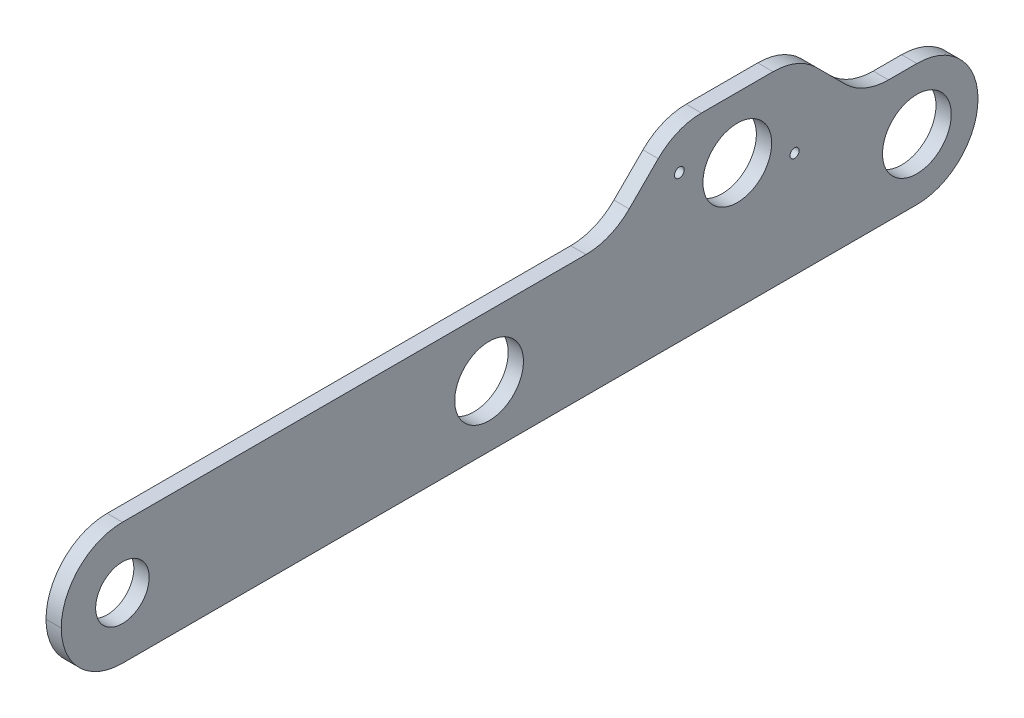
from build123d import *

# Parameters (mm, degrees)
SKETCH1_R           = 11.1125
SKETCH1_R_2         = 14.2875
SKETCH1_R_3         = 1.903475963
SKETCH1_R_4         = 2.0193
BOSS_EXTRUDE1_DEPTH = 6.35
FILLET1_R           = 25.4


with BuildPart() as part:
    # Sketch1 → Boss-Extrude1 (new body)
    with BuildSketch(Plane(origin=(0, 0, 0), x_dir=(0, 0, -1), z_dir=(1, 0, 0))):
        Polygon((0, 0), (0, 50.8), (228.6, 50.8), (255.540768363, 77.740768363), (306.340768363, 77.740768363), (333.281536726, 50.8), (381, 50.8), (381, 0), align=None)
        with Locations((25.4, 25.4)):
            Circle(SKETCH1_R, mode=Mode.SUBTRACT)
        with Locations((280.957536726, 52.340768363)):
            Circle(SKETCH1_R_2, mode=Mode.SUBTRACT)
        with Locations((355.6, 25.4)):
            Circle(SKETCH1_R_2, mode=Mode.SUBTRACT)
        with Locations((177.8, 25.4)):
            Circle(SKETCH1_R_2, mode=Mode.SUBTRACT)
        with Locations((304.762985996, 43.955677033)):
            Circle(SKETCH1_R_3, mode=Mode.SUBTRACT)
        with Locations((256.876798248, 60.913065482)):
            Circle(SKETCH1_R_4, mode=Mode.SUBTRACT)
    extrude(amount=BOSS_EXTRUDE1_DEPTH)

    # Fillet1
    fillet1_edges = [part.edges().sort_by_distance(p)[0] for p in [
        (3.175, 50.8, -228.6),
        (3.175, 50.8, -333.281536726),
        (3.175, 77.740768363, -306.340768363),
        (3.175, 77.740768363, -255.540768363),
        (3.175, 0, -381),
        (3.175, 50.8, -381),
        (3.175, 0, 0),
        (3.175, 50.8, 0),
    ]]
    fillet(fillet1_edges, radius=FILLET1_R - 0.0001)  # a hair under: the kernel refuses the full size


solid = part.part
